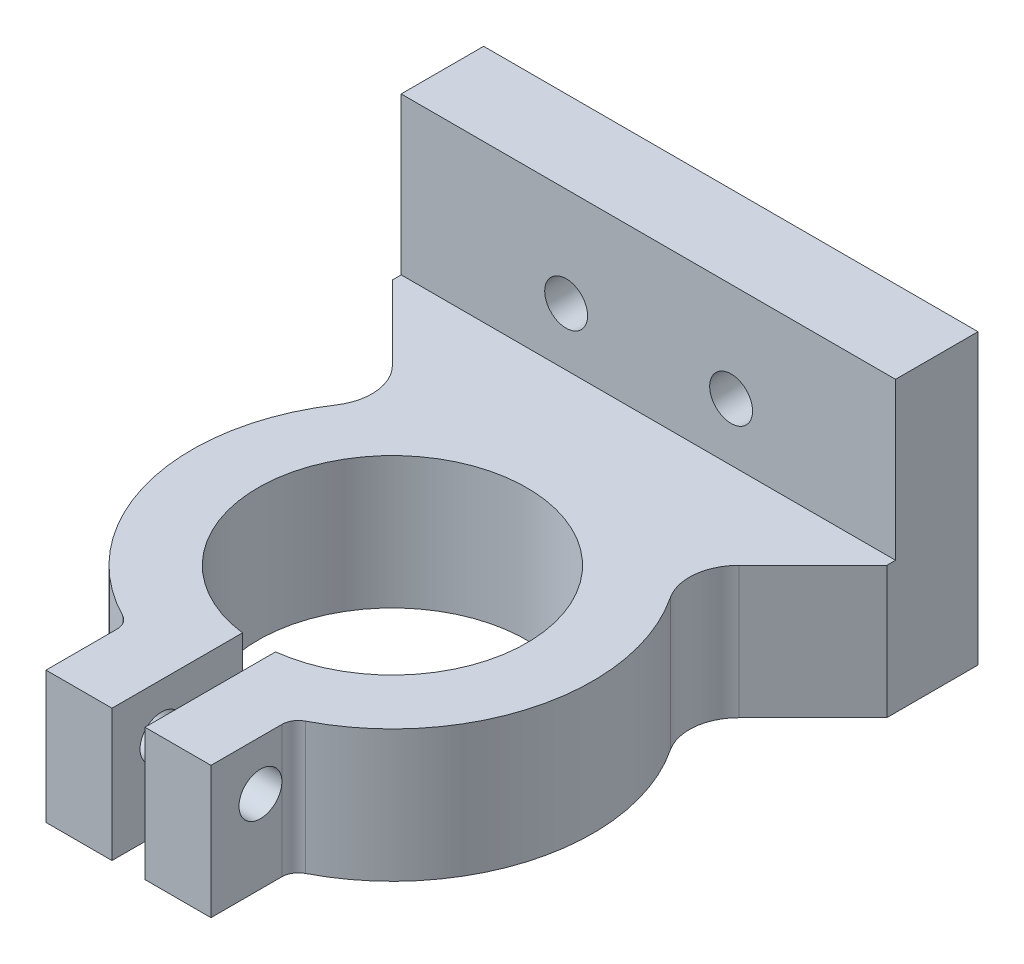
from build123d import *

# Parameters (mm, degrees)
EXTRUDE_THIN1_DEPTH     = 60
BOSS_EXTRUDE1_DEPTH     = 16
CUT_EXTRUDE1_DEPTH      = 103.764416295
CUT_EXTRUDE2_DEPTH      = 109.697401073
FILLET2_R               = 2
CUT_EXTRUDE3_DEPTH      = 109.697401073
CUT_EXTRUDE3_DEPTH_BACK = 109.697401073
SKETCH6_R               = 2.6
CUT_EXTRUDE4_DEPTH      = 103.764416295
CUT_EXTRUDE4_DEPTH_BACK = 103.764416295
SKETCH7_W               = 78.423709943
SKETCH7_H               = 52.802383793
SKETCH8_W               = 51.319796382
SKETCH8_H               = 40.051163843
BOSS_EXTRUDE2_DEPTH     = 16
SKETCH9_W               = 91.777168916
SKETCH9_H               = 33.81264118
CUT_EXTRUDE5_DEPTH      = 93.038714698
SKETCH12_W              = 62.932503526
SKETCH12_H              = 35
SKETCH12_R              = 2.6
BOSS_EXTRUDE5_DEPTH     = 10
CUT_EXTRUDE6_DEPTH      = 93.607370117
CUT_EXTRUDE6_DEPTH_BACK = 93.607370117
SKETCH13_W              = 157.086871367
SKETCH13_H              = 169.783274599
SKETCH13_W_2            = 59.932503526
SKETCH13_H_2            = 122.233999749
FILLET6_R               = 6
SKETCH14_R              = 1.75
CUT_EXTRUDE7_DEPTH      = 15
CUT_EXTRUDE8_DEPTH      = 30


with BuildPart() as part:
    # Sketch1 → Extrude-Thin1 (new body)
    with BuildSketch(Plane(origin=(0, 0, 0), x_dir=(1, 0, 0), z_dir=(0, 1, 0))):
        Polygon((-28.637824638, -0.353553391), (0, -28.991378029), (28.637824638, -0.353553391), (31.466251763, -3.181980515), (0, -34.648232278), (-31.466251763, -3.181980515), align=None)
    extrude(amount=EXTRUDE_THIN1_DEPTH)

    # Sketch2 → Boss-Extrude1 (add)
    with BuildSketch(Plane(origin=(0, 0, 0), x_dir=(1, 0, 0), z_dir=(0, 1, 0))):
        with BuildLine():
            Line((-31.466251763, -3.181980515), (-31.466251763, -85))
            Line((-31.466251763, -85), (-2, -85))
            Line((-2, -85), (-2, -69.17683529))
            ThreePointArc((-2, -69.17683529), (0, -36.7), (2, -69.17683529))
            Line((2, -69.17683529), (2, -85))
            Line((2, -85), (31.466251763, -85))
            Line((31.466251763, -85), (31.466251763, -3.181980515))
            Line((31.466251763, -3.181980515), (0, -34.648232278))
            Line((0, -34.648232278), (-31.466251763, -3.181980515))
        make_face()
    extrude(amount=BOSS_EXTRUDE1_DEPTH)

    # Sketch3 → Cut-Extrude1 (cut, through all)
    with BuildSketch(Plane(origin=(17.324116139, 0, 17.324116139), x_dir=(0.7071067811865475, 0, -0.7071067811865476), z_dir=(0.7071067811865476, 0, 0.7071067811865475))):
        with BuildLine():
            Line((2.75, 50), (2.75, 20))
            ThreePointArc((2.75, 20), (0, 17.25), (-2.75, 20))
            Line((-2.75, 20), (-2.75, 50))
            ThreePointArc((-2.75, 50), (0, 52.75), (2.75, 50))
        make_face()
    cut_extrude1 = extrude(amount=-CUT_EXTRUDE1_DEPTH, mode=Mode.SUBTRACT)

    # Mirror1: Cut-Extrude1 across plane
    add(cut_extrude1.mirror(Plane(origin=(0, 0, 0), x_dir=(0, 0, 1), z_dir=(1, 0, 0))), mode=Mode.SUBTRACT)

    # Sketch5 → Cut-Extrude2 (cut, through all)
    with BuildSketch(Plane(origin=(0, 0, 0), x_dir=(1, 0, 0), z_dir=(0, 1, 0))):
        with BuildLine():
            Line((-31.466251763, -21.533748237), (-17.182694783, -35.817305217))
            ThreePointArc((-17.182694783, -35.817305217), (-23.904625503, -57.365647669), (-10, -75.147008827))
            Line((-10, -75.147008827), (-10, -85))
            Line((-10, -85), (-31.466251763, -85))
            Line((-31.466251763, -85), (-31.466251763, -21.533748237))
        make_face()
    cut_extrude2 = extrude(amount=CUT_EXTRUDE2_DEPTH, mode=Mode.SUBTRACT)

    # Mirror2: Cut-Extrude2 across plane
    add(cut_extrude2.mirror(Plane(origin=(0, 0, 0), x_dir=(0, 0, 1), z_dir=(1, 0, 0))), mode=Mode.SUBTRACT)

    # Fillet2
    fillet2_edges = [part.edges().sort_by_distance(p)[0] for p in [
        (10, 8, 75.147008827),
        (-10, 8, 75.147008827),
    ]]
    fillet(fillet2_edges, radius=FILLET2_R)

    # Sketch6 → Cut-Extrude3 (cut, two sides: drawn at the far end of the back side and taken through both)
    with BuildSketch(Plane(origin=(0, 0, 0), x_dir=(0, 0, -1), z_dir=(1, 0, 0)).offset(-CUT_EXTRUDE3_DEPTH_BACK)):
        with Locations((-79, 10)):
            Circle(SKETCH6_R)
    extrude(amount=CUT_EXTRUDE3_DEPTH + CUT_EXTRUDE3_DEPTH_BACK, mode=Mode.SUBTRACT)

    # Sketch7 → Cut-Extrude4 (cut, two sides: drawn at the far end of the back side and taken through both)
    with BuildSketch(Plane(origin=(-17.324116139, 0, 17.324116139), x_dir=(0.7071067811865475, 0, 0.7071067811865476), z_dir=(-0.7071067811865476, 0, 0.7071067811865475)).offset(-CUT_EXTRUDE4_DEPTH_BACK)):
        with Locations((-0.892385334, 42.401191897)):
            Rectangle(SKETCH7_W, SKETCH7_H)
    extrude(amount=CUT_EXTRUDE4_DEPTH + CUT_EXTRUDE4_DEPTH_BACK, mode=Mode.SUBTRACT)

    # Sketch8 → Boss-Extrude2 (add)
    with BuildSketch(Plane(origin=(0, 16, 0), x_dir=(1, 0, 0), z_dir=(0, 1, 0))):
        with Locations((0.329762311, -10.635090251)):
            Rectangle(SKETCH8_W, SKETCH8_H)
    extrude(amount=-BOSS_EXTRUDE2_DEPTH)

    # Sketch9 → Cut-Extrude5 (cut, through all)
    with BuildSketch(Plane(origin=(0, 16, 0), x_dir=(1, 0, 0), z_dir=(0, 1, 0))):
        with Locations((0.452847873, -5.06743142)):
            Rectangle(SKETCH9_W, SKETCH9_H)
    extrude(amount=-CUT_EXTRUDE5_DEPTH, mode=Mode.SUBTRACT)

    # Sketch12 → Boss-Extrude5 (add)
    with BuildSketch(Plane(origin=(0, 0, 21.97375201), x_dir=(-1, 0, 0), z_dir=(0, 0, -1))):
        with Locations((0, 17.5)):
            Rectangle(SKETCH12_W, SKETCH12_H)
        with Locations((-10.033748237, 23)):
            Circle(SKETCH12_R, mode=Mode.SUBTRACT)
        with Locations((9.966251763, 23)):
            Circle(SKETCH12_R, mode=Mode.SUBTRACT)
    extrude(amount=BOSS_EXTRUDE5_DEPTH)

    # Sketch13 → Cut-Extrude6 (cut, two sides: drawn at the far end of the back side and taken through both)
    with BuildSketch(Plane(origin=(0, 16, 0), x_dir=(1, 0, 0), z_dir=(0, 1, 0)).offset(-CUT_EXTRUDE6_DEPTH_BACK)):
        with Locations((-2.365016289, -53.735825088)):
            Rectangle(SKETCH13_W, SKETCH13_H)
        with Locations((0, -51.3708088)):
            Rectangle(SKETCH13_W_2, SKETCH13_H_2, mode=Mode.SUBTRACT)
    extrude(amount=CUT_EXTRUDE6_DEPTH + CUT_EXTRUDE6_DEPTH_BACK, mode=Mode.SUBTRACT)

    # Fillet6
    fillet6_edges = [part.edges().sort_by_distance(p)[0] for p in [
        (-17.182694783, 8, 35.817305217),
        (17.182694783, 8, 35.817305217),
    ]]
    fillet(fillet6_edges, radius=FILLET6_R)

    # Sketch14 → Cut-Extrude7 (cut)
    with BuildSketch(Plane(origin=(0, 0, 11.97375201), x_dir=(-1, 0, 0), z_dir=(0, 0, -1))):
        with Locations((0, 10)):
            Circle(SKETCH14_R)
    extrude(amount=-CUT_EXTRUDE7_DEPTH, mode=Mode.SUBTRACT)

    # Sketch15 → Cut-Extrude8 (cut)
    with BuildSketch(Plane(origin=(0, 16, 0), x_dir=(1, 0, 0), z_dir=(0, 1, 0))):
        Polygon((25.989660502, -27.010339498), (22.339327827, -30.660672173), (25.989660502, -30.660672173), align=None)
        Polygon((-25.989660502, -30.660672173), (-25.989660502, -27.010339498), (-22.339327827, -30.660672173), align=None)
    extrude(amount=-CUT_EXTRUDE8_DEPTH, mode=Mode.SUBTRACT)


solid = part.part
